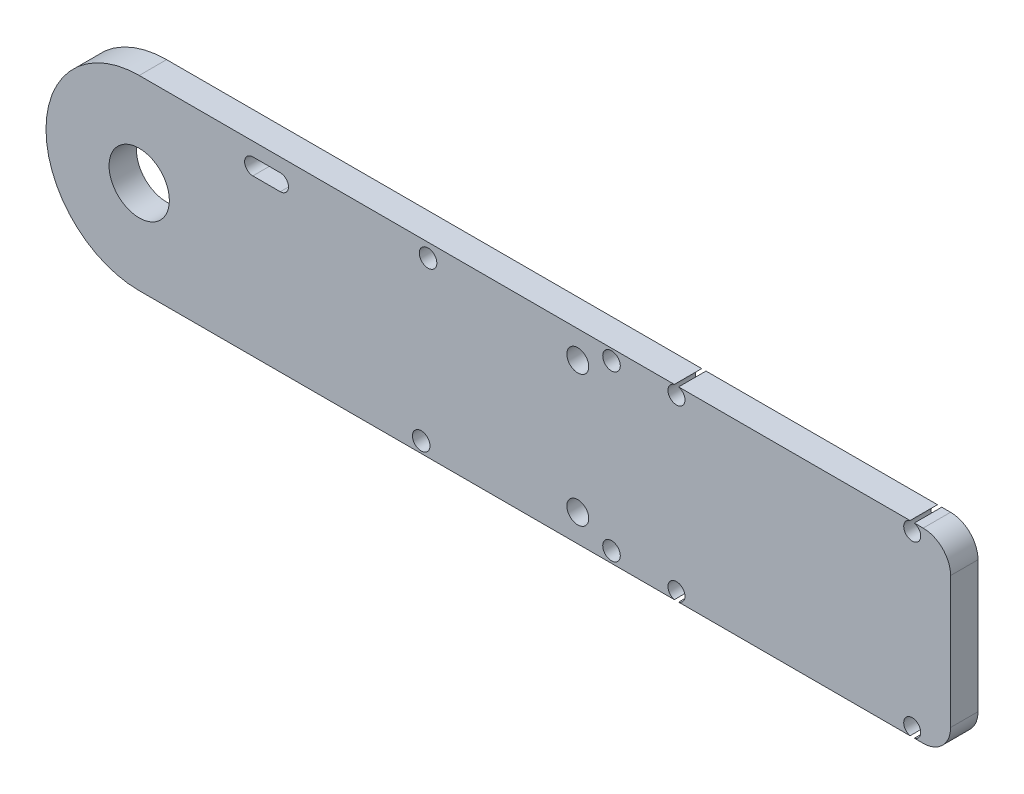
from build123d import *

# Parameters (mm, degrees)
SKETCH2_R           = 5.5
BOSS_EXTRUDE1_DEPTH = 2.5
FILLET1_R           = 5
SKETCH3_R           = 1.6
SKETCH3_R_2         = 2
CUT_EXTRUDE1_DEPTH  = 150.057036063
SKETCH3_4_R         = 1.6
SKETCH3_4_R_2       = 2
CUT_EXTRUDE2_DEPTH  = 10


with BuildPart() as part:
    # Sketch2 → Boss-Extrude1 (new, symmetric)
    with BuildSketch(Plane.XY):
        with BuildLine():
            Line((148, 17), (0, 17))
            ThreePointArc((0, 17), (-17, 0), (0, -17))
            Line((0, -17), (148, -17))
            Line((148, -17), (148, 17))
        make_face()
        Circle(SKETCH2_R, mode=Mode.SUBTRACT)
    extrude(amount=BOSS_EXTRUDE1_DEPTH, both=True)

    # Fillet1
    fillet1_edges = [part.edges().sort_by_distance(p)[0] for p in [
        (148, -17, 0),
        (148, 17, 0),
    ]]
    fillet(fillet1_edges, radius=FILLET1_R)

    # Sketch3 → Cut-Extrude1 (cut, through all)
    with BuildSketch(Plane(origin=(0, 0, -2.5), x_dir=(-1, 0, 0), z_dir=(0, 0, -1))):
        with BuildLine():
            Line((-97.609487516, 17), (-98.390512484, 17))
            ThreePointArc((-98.390512484, 17), (-99.537449186, 15.303149803), (-98, 13.95))
            ThreePointArc((-98, 13.95), (-96.462550814, 15.303149803), (-97.609487516, 17))
        make_face()
        with BuildLine():
            ThreePointArc((-141.390512484, 17), (-141, 13.95), (-140.609487516, 17))
            Line((-140.609487516, 17), (-141.390512484, 17))
        make_face()
        with Locations((-86.148976128, 15)):
            Circle(SKETCH3_R)
        with Locations((-80, 12)):
            Circle(SKETCH3_R_2)
        with BuildLine():
            Line((-141.390512484, -17), (-140.609487516, -17))
            ThreePointArc((-140.609487516, -17), (-141, -13.95), (-141.390512484, -17))
        make_face()
        with BuildLine():
            ThreePointArc((-97.609487516, -17), (-98, -13.95), (-98.390512484, -17))
            Line((-98.390512484, -17), (-97.609487516, -17))
        make_face()
        with BuildLine():
            Line((-20.729077373, 14.5), (-25.729077373, 14.5))
            ThreePointArc((-25.729077373, 14.5), (-27.229077373, 13), (-25.729077373, 11.5))
            Line((-25.729077373, 11.5), (-20.729077373, 11.5))
            ThreePointArc((-20.729077373, 11.5), (-19.229077373, 13), (-20.729077373, 14.5))
        make_face()
        with Locations((-86.148976128, -15)):
            Circle(SKETCH3_R)
        with Locations((-80, -12)):
            Circle(SKETCH3_R_2)
    extrude(amount=-CUT_EXTRUDE1_DEPTH, mode=Mode.SUBTRACT)

    # Sketch3<4> → Cut-Extrude2 (cut)
    with BuildSketch(Plane(origin=(0, 0, -2.5), x_dir=(-1, 0, 0), z_dir=(0, 0, -1))):
        with BuildLine():
            Line((-97.609487516, 17), (-98.390512484, 17))
            ThreePointArc((-98.390512484, 17), (-99.537449186, 15.303149803), (-98, 13.95))
            ThreePointArc((-98, 13.95), (-96.462550814, 15.303149803), (-97.609487516, 17))
        make_face()
        with BuildLine():
            ThreePointArc((-141.390512484, 17), (-141, 13.95), (-140.609487516, 17))
            Line((-140.609487516, 17), (-141.390512484, 17))
        make_face()
        with Locations((-86.148976128, 15)):
            Circle(SKETCH3_4_R)
        with Locations((-80, 12)):
            Circle(SKETCH3_4_R_2)
        with BuildLine():
            Line((-141.390512484, -17), (-140.609487516, -17))
            ThreePointArc((-140.609487516, -17), (-141, -13.95), (-141.390512484, -17))
        make_face()
        with BuildLine():
            ThreePointArc((-97.609487516, -17), (-98, -13.95), (-98.390512484, -17))
            Line((-98.390512484, -17), (-97.609487516, -17))
        make_face()
        with BuildLine():
            Line((-20.729077373, 14.5), (-25.729077373, 14.5))
            ThreePointArc((-25.729077373, 14.5), (-27.229077373, 13), (-25.729077373, 11.5))
            Line((-25.729077373, 11.5), (-20.729077373, 11.5))
            ThreePointArc((-20.729077373, 11.5), (-19.229077373, 13), (-20.729077373, 14.5))
        make_face()
        with Locations((-86.148976128, -15)):
            Circle(SKETCH3_4_R)
        with Locations((-51.438731476, -15)):
            Circle(SKETCH3_4_R)
        with Locations((-52.687378506, 14.5)):
            Circle(SKETCH3_4_R)
        with Locations((-80, -12)):
            Circle(SKETCH3_4_R_2)
    extrude(amount=-CUT_EXTRUDE2_DEPTH, mode=Mode.SUBTRACT)


solid = part.part
